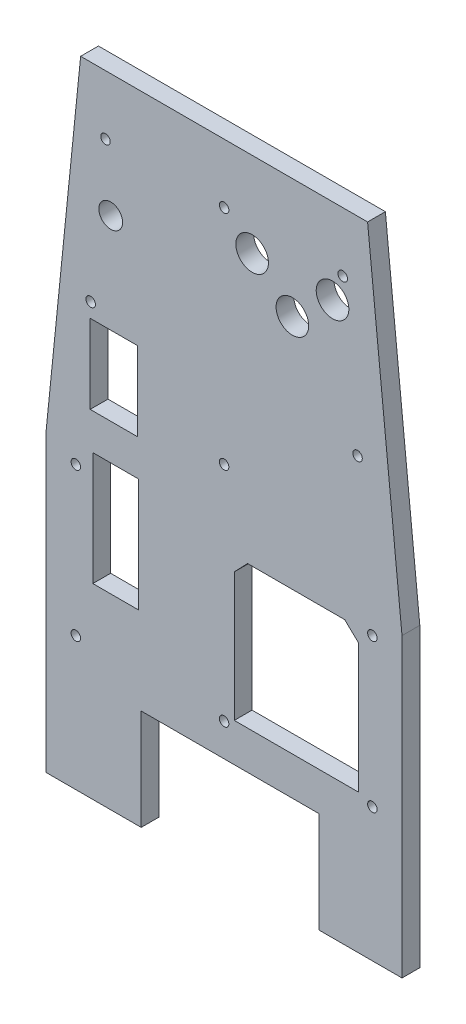
from build123d import *

# Parameters (mm, degrees)
ESQUISSE1_W                    = 120
ESQUISSE1_H                    = 215
BOSS_EXTRU_1_DEPTH             = 6
ESQUISSE2_R                    = 1.6
ENL_V_MAT_EXTRU_1_DEPTH        = 138.798088748
R_P_TITION_LIN_AIRE1_OUTLINE_R = 1.6
R_P_TITION_LIN_AIRE1_DEPTH     = 6
ESQUISSE3_R                    = 4
ESQUISSE3_R_2                  = 5.5
ESQUISSE3_W                    = 15.409626965
ESQUISSE3_H                    = 38.248473635
ESQUISSE3_W_2                  = 15.900745579
ESQUISSE3_H_2                  = 26.603255198
ENL_V_MAT_EXTRU_2_DEPTH        = 138.798088748
ENL_V_MAT_EXTRU_3_DEPTH        = 138.798088748
ENL_V_MAT_EXTRU_4_DEPTH        = 138.798088748
ENL_V_MAT_EXTRU_4_DEPTH_BACK   = 138.798088748
ESQUISSE5_W                    = 60
ESQUISSE5_H                    = 33.99999972


# Read off the part's stored shape, not the designer's step: Répétition linéaire1
with BuildPart() as part:
    # Esquisse1 → Boss.-Extru.1 (new body)
    with BuildSketch(Plane.XY):
        with Locations((22.778700537, 2.5)):
            Rectangle(ESQUISSE1_W, ESQUISSE1_H)
    extrude(amount=BOSS_EXTRU_1_DEPTH)

    # Esquisse2 → Enlèv. mat.-Extru.1 (cut, through all)
    with BuildSketch(Plane.XY.offset(6)):
        with Locations((-27.221299463, -60)):
            Circle(ESQUISSE2_R)
    extrude(amount=-ENL_V_MAT_EXTRU_1_DEPTH, mode=Mode.SUBTRACT)

    # Répétition linéaire1 outline → Répétition linéaire1 (cut)
    with BuildSketch(Plane.XY):
        with Locations((-27.221299463, -10)):
            Circle(R_P_TITION_LIN_AIRE1_OUTLINE_R)
        with Locations((-22.221299463, 40)):
            Circle(R_P_TITION_LIN_AIRE1_OUTLINE_R)
        with Locations((-17.221299463, 90)):
            Circle(R_P_TITION_LIN_AIRE1_OUTLINE_R)
        with Locations((22.778700537, -60)):
            Circle(R_P_TITION_LIN_AIRE1_OUTLINE_R)
        with Locations((22.778700537, 15)):
            Circle(R_P_TITION_LIN_AIRE1_OUTLINE_R)
        with Locations((62.778700537, 90)):
            Circle(R_P_TITION_LIN_AIRE1_OUTLINE_R)
        with Locations((67.778700537, 40)):
            Circle(R_P_TITION_LIN_AIRE1_OUTLINE_R)
        with Locations((72.778700537, -10)):
            Circle(R_P_TITION_LIN_AIRE1_OUTLINE_R)
        with Locations((72.778700537, -60)):
            Circle(R_P_TITION_LIN_AIRE1_OUTLINE_R)
        with Locations((22.778700537, 90)):
            Circle(R_P_TITION_LIN_AIRE1_OUTLINE_R)
    extrude(amount=R_P_TITION_LIN_AIRE1_DEPTH, mode=Mode.SUBTRACT)

    # Esquisse3 → Enlèv. mat.-Extru.2 (cut, through all)
    with BuildSketch(Plane(origin=(0, 0, 0), x_dir=(-1, 0, 0), z_dir=(0, 0, -1))):
        with Locations((15.455236492, 68.53256443)):
            Circle(ESQUISSE3_R)
        with Locations((-32.238615261, 81.334914602)):
            Circle(ESQUISSE3_R_2)
        with Locations((-59.338617549, 81.334914602)):
            Circle(ESQUISSE3_R_2)
        with Locations((-45.804685817, 69.740615286)):
            Circle(ESQUISSE3_R_2)
        Polygon((-68.153753001, -58.054646), (-26.204418495, -58.054646), (-26.204418495, -14.671183794), (-30.693922011, -10.00000011), (-63.437167878, -10.00000011), (-68.153753001, -14.47508178), align=None)
        with Locations((13.783655533, -22.813946783)):
            Rectangle(ESQUISSE3_W, ESQUISSE3_H)
        with Locations((14.437094465, 21.783177691)):
            Rectangle(ESQUISSE3_W_2, ESQUISSE3_H_2)
        with BuildLine():
            Line((-30.778700537, -101), (-30.778700537, -105))
            Line((-30.778700537, -105), (-14.778700537, -105))
            Line((-14.778700537, -105), (-14.778700537, -101))
            ThreePointArc((-14.778700537, -101), (-22.778700537, -93), (-30.778700537, -101))
        make_face()
    extrude(amount=-ENL_V_MAT_EXTRU_2_DEPTH, mode=Mode.SUBTRACT)

    # Esquisse4 → Enlèv. mat.-Extru.3 (cut, through all)
    with BuildSketch(Plane.XY.offset(6)):
        Polygon((-37.221299463, 110), (-37.221299463, -5.00000078), (-25.60513741, 110), align=None)
        Polygon((71.162538485, 110), (82.778700537, 110), (82.778700537, -5.00000078), align=None)
    extrude(amount=-ENL_V_MAT_EXTRU_3_DEPTH, mode=Mode.SUBTRACT)

    # Esquisse5 → Enlèv. mat.-Extru.4 (cut, two sides: drawn at the far end of the back side and taken through both)
    with BuildSketch(Plane(origin=(0, 0, 0), x_dir=(-1, 0, 0), z_dir=(0, 0, -1)).offset(-ENL_V_MAT_EXTRU_4_DEPTH_BACK)):
        with Locations((-24.818757264, -88.00000014)):
            Rectangle(ESQUISSE5_W, ESQUISSE5_H)
    extrude(amount=ENL_V_MAT_EXTRU_4_DEPTH + ENL_V_MAT_EXTRU_4_DEPTH_BACK, mode=Mode.SUBTRACT)


solid = part.part
